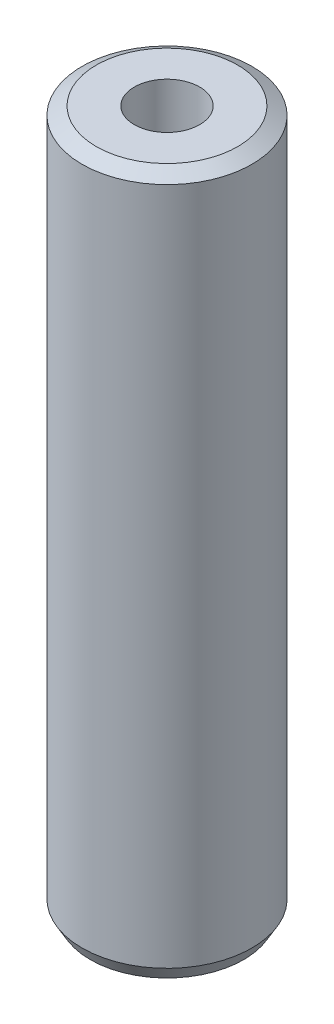
from build123d import *
from OCP.BRepFilletAPI import BRepFilletAPI_MakeChamfer

# Parameters (mm, degrees)
SKETCH1_R           = 45
BOSS_EXTRUDE1_DEPTH = 371.531253071
SKETCH2_R           = 17.318554324
CUT_EXTRUDE1_DEPTH  = 377.942266147
CHAMFER1_SIZE       = 4.348158517
CHAMFER1_SIZE2      = 7.531231471


with BuildPart() as part:
    # Sketch1 → Boss-Extrude1 (new body)
    with BuildSketch(Plane(origin=(0, 0, 0), x_dir=(1, 0, 0), z_dir=(0, 1, 0))):
        Circle(SKETCH1_R)
    extrude(amount=BOSS_EXTRUDE1_DEPTH)

    # Sketch2 → Cut-Extrude1 (cut, through all)
    with BuildSketch(Plane(origin=(0, 0, 0), x_dir=(1, 0, 0), z_dir=(0, 1, 0))):
        Circle(SKETCH2_R)
    extrude(amount=CUT_EXTRUDE1_DEPTH, mode=Mode.SUBTRACT)

    # Chamfer1: one chamfer whose edges measure the first distance from different faces: ONE call of the kernel's chamfer builder (chamfer() names one face for all edges)
    chamfer1_edges_1 = [part.edges().sort_by_distance(p)[0] for p in [
        (-45, 371.531253071, 0),
    ]]
    chamfer1_side_1 = [part.faces().sort_by_distance(p)[0] for p in [
        (-45, 185.765626535, 0),
    ]]
    chamfer1_edges_2 = [part.edges().sort_by_distance(p)[0] for p in [
        (-45, 0, 0),
    ]]
    chamfer1_side_2 = [part.faces().sort_by_distance(p)[0] for p in [
        (-43.727207794, 0, 0),
    ]]
    chamfer1 = BRepFilletAPI_MakeChamfer(part.part.solid().wrapped)
    for e in chamfer1_edges_1:
        chamfer1.Add(CHAMFER1_SIZE, CHAMFER1_SIZE2, e.wrapped, chamfer1_side_1[0].wrapped)  # the first distance lies on this face
    for e in chamfer1_edges_2:
        chamfer1.Add(CHAMFER1_SIZE, CHAMFER1_SIZE2, e.wrapped, chamfer1_side_2[0].wrapped)  # the first distance lies on this face
    add(Compound.cast(chamfer1.Shape()), mode=Mode.REPLACE)


solid = part.part
